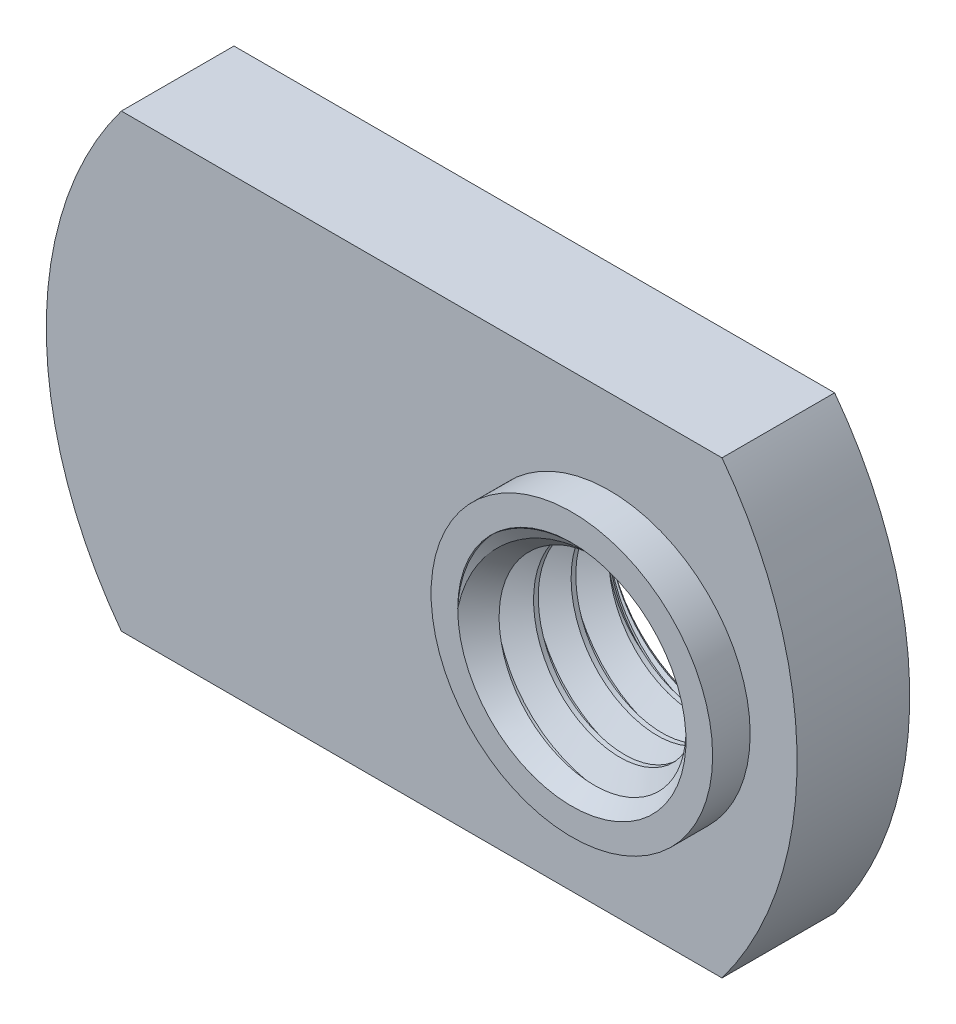
from build123d import *

# Parameters (mm, degrees)
SKETCH1_R          = 2.413
EXTRUDE1_DEPTH     = 2.38125
SKETCH2_R          = 2.9765625
SKETCH2_R_2        = 2.413
EXTRUDE2_DEPTH     = 0.79375
SWEEP1_PITCH       = 0.79375
CUT_EXTRUDE1_DEPTH = 12.692773633
SKETCH7_R          = 2.9765625
CUT_EXTRUDE3_DEPTH = 11.071626716


with BuildPart() as part:
    # Sketch1 → Extrude1 (new body)
    with BuildSketch(Plane.XY):
        with BuildLine():
            Line((-6.35, 4.7625), (6.35, 4.7625))
            ThreePointArc((6.35, 4.7625), (7.9375, 0), (6.35, -4.7625))
            Line((6.35, -4.7625), (-6.35, -4.7625))
            ThreePointArc((-6.35, -4.7625), (-7.9375, 0), (-6.35, 4.7625))
        make_face()
        with Locations(Location((3.96875, 0, 0), (0, 0, 180))):
            Circle(SKETCH1_R, mode=Mode.SUBTRACT)
    extrude(amount=EXTRUDE1_DEPTH)

    # Sketch2 → Extrude2 (add)
    with BuildSketch(Plane.XY.offset(2.38125)):
        with Locations((3.96875, 0)):
            Circle(SKETCH2_R)
        with Locations(Location((3.96875, 0, 0), (0, 0, 180))):
            Circle(SKETCH2_R_2, mode=Mode.SUBTRACT)
    extrude(amount=EXTRUDE2_DEPTH)

    # Sweep1: the profile of Sketch4 profile screwed along a right-hand helix of 9 turns, 6 arcs to a turn; built about Z, then put on its axis
    sweep1_z = Axis((0, 0, 0), (0, 0, 1))
    sweep1_corners = [(2.4133, 0, -0.694704455), (2.4133, 0, 0.000173205), (1.897444252, 0, -0.29765625), (1.897444252, 0, -0.396875)]
    with BuildLine(mode=Mode.PRIVATE) as sweep1_profile:
        Line(sweep1_corners[0], sweep1_corners[1])
        Line(sweep1_corners[1], sweep1_corners[2])
        Line(sweep1_corners[2], sweep1_corners[3])
        Line(sweep1_corners[3], sweep1_corners[0])
    sweep1_cap = Face(sweep1_profile.wire())
    sweep1_turn_angles = [0, 30, 60, 90, 120, 150, 180, 210, 240, 270, 300, 330, 360]
    sweep1_turn_weights = [1, 0.8660254037844387, 1, 0.8660254037844387, 1, 0.8660254037844387, 1, 0.8660254037844387, 1, 0.8660254037844387, 1, 0.8660254037844387, 1]
    sweep1_turn_rails = [Edge.make_bspline([Vector(p[0], p[1], 0).rotate(sweep1_z, sweep1_turn_angles[k]) / sweep1_turn_weights[k] + Vector(0, 0, p[2] + SWEEP1_PITCH * sweep1_turn_angles[k] / 360) for k in range(13)], [0, 0, 0, 1, 1, 2, 2, 3, 3, 4, 4, 5, 5, 6, 6, 6], 2, sweep1_turn_weights) for p in sweep1_corners]
    sweep1_turn_sides = [Face.make_surface_from_curves(sweep1_turn_rails[p[0]], sweep1_turn_rails[p[1]]) for p in [(0, 1), (1, 2), (2, 3), (3, 0)]]
    sweep1 = Plane(origin=(3.96875, 0, 0), x_dir=(-1, 0, 0), z_dir=(0, 0, 1)) * Solid(Shell([*[p.moved(Location((0, 0, SWEEP1_PITCH * i))) for i in range(9) for p in sweep1_turn_sides], sweep1_cap, sweep1_cap.rotate(sweep1_z, 3240).moved(Location((0, 0, SWEEP1_PITCH * 3240 / 360)))]))
    add(sweep1)

    # Sketch5 → Cut-Extrude1 (cut, through all)
    with BuildSketch(Plane(origin=(0, 0, 0), x_dir=(-1, 0, 0), z_dir=(0, 0, -1))):
        with BuildLine():
            Line((-6.35, -4.7625), (6.35, -4.7625))
            ThreePointArc((6.35, -4.7625), (7.9375, 0), (6.35, 4.7625))
            Line((6.35, 4.7625), (-6.35, 4.7625))
            ThreePointArc((-6.35, 4.7625), (-7.9375, 0), (-6.35, -4.7625))
        make_face()
    extrude(amount=CUT_EXTRUDE1_DEPTH, mode=Mode.SUBTRACT)

    # Cut-Extrude2 cone 1 section (through the dimple's axis) → Cut-Extrude2 (revolve, cut)
    with BuildSketch(Plane.YZ.offset(3.96875)):
        Polygon((0, 0), (2.413, 0), (0, 2.413), align=None)
    revolve(axis=Axis((3.96875, 0, 0), (0, 0, 1)), mode=Mode.SUBTRACT)

    # Sketch7 → Cut-Extrude3 (cut, through all)
    with BuildSketch(Plane.XY.offset(3.175)):
        with Locations((3.96875, 0)):
            Circle(SKETCH7_R)
    extrude(amount=CUT_EXTRUDE3_DEPTH, mode=Mode.SUBTRACT)

    # Cut-Extrude4 cone 1 section (through the dimple's axis) → Cut-Extrude4 (revolve, cut)
    with BuildSketch(Plane(origin=(3.96875, 0, 3.175), x_dir=(0, -1, 0), z_dir=(1, 0, 0))):
        Polygon((0, 0), (2.413, 0), (0, 2.413), align=None)
    revolve(axis=Axis((3.96875, 0, 3.175), (0, 0, -1)), mode=Mode.SUBTRACT)


solid = part.part
